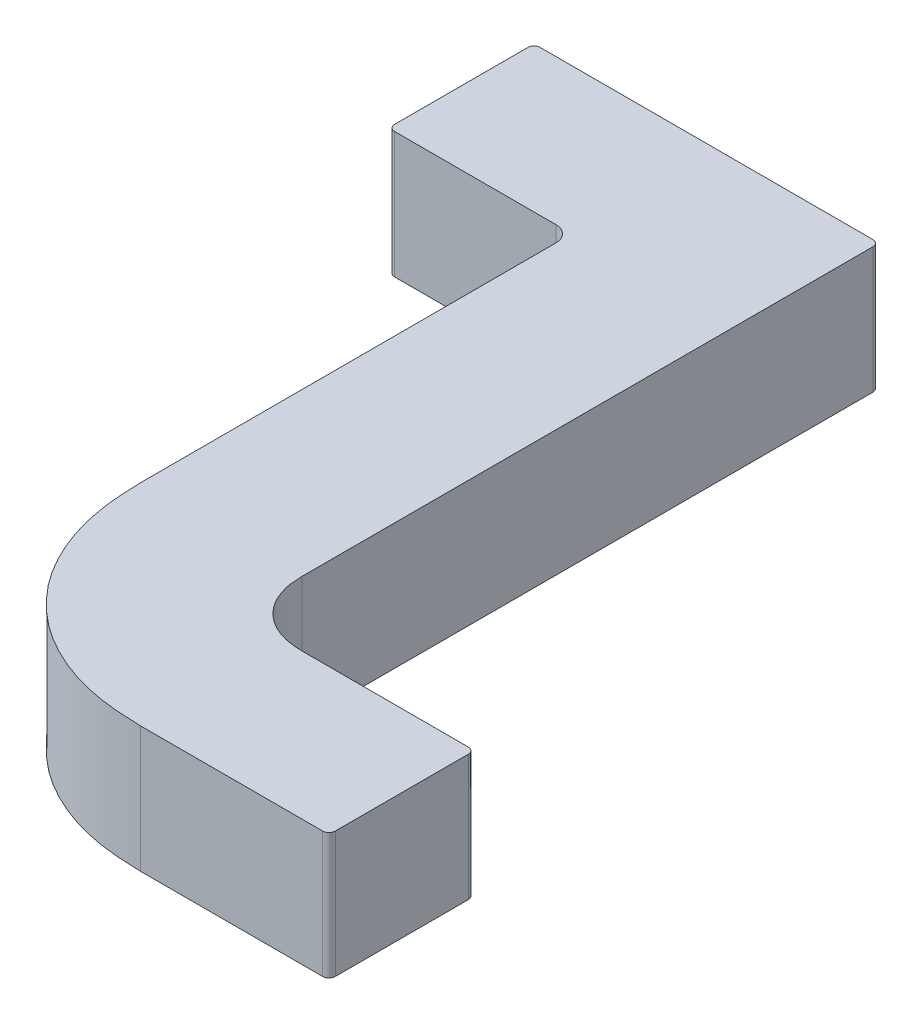
from build123d import *

# Parameters (mm, degrees)
BOSS_EXTRUDE1_DEPTH = 20
FILLET1_R           = 2.5
FILLET2_R           = 1


with BuildPart() as part:
    # Sketch1 → Boss-Extrude1 (new body)
    with BuildSketch(Plane(origin=(0, 0, 0), x_dir=(1, 0, 0), z_dir=(0, 1, 0))):
        with BuildLine():
            add(Edge.make_bspline(
                [(66.785572731, 0), (65.180738733, 0.054671083), (62.042961796, 0.161564173), (57.483422286, 0.927629424), (53.226087858, 2.248485383), (49.300163086, 4.093927927), (45.706807663, 6.38128482), (42.579503305, 9.186716939), (39.774071186, 12.314021298), (37.486714293, 15.907376721), (35.641271749, 19.833301493), (34.320415789, 24.090635921), (33.554350539, 28.65017543), (33.447457449, 31.787952367), (33.392786365, 33.392786365)],
                knots=[0, 0, 0, 0, 1.087768186, 2.126808089, 3.123655961, 4.100353148, 5.059975733, 6, 6.940024267, 7.899646852, 8.876344039, 9.873191911, 10.912231814, 12, 12, 12, 12], degree=3))
            Line((33.392786365, 33.392786365), (33.392786365, 101.887633769))
            Line((33.392786365, 101.887633769), (4.285572731, 101.887633769))
            Line((4.285572731, 101.887633769), (4.285572731, 125))
            Line((4.285572731, 125), (59.081450654, 125))
            Line((59.081450654, 125), (59.081450654, 33.392786365))
            add(Edge.make_bspline(
                [(59.081450654, 33.392786365), (59.109085671, 32.653826149), (59.162403998, 31.228094331), (59.729901482, 29.220411071), (60.610011976, 27.42312516), (61.857229604, 25.888144946), (63.392207772, 24.640926671), (65.189502542, 23.760820831), (67.189160306, 23.195562332), (68.606475262, 23.140665469), (69.337098692, 23.112366231)],
                knots=[0, 0, 0, 0, 1.083242442, 2.089981545, 3.039600891, 4.006048006, 4.972495121, 5.922114466, 6.928853569, 8, 8, 8, 8], degree=3))
            Line((69.337098692, 23.112366231), (96.735037654, 23.112366231))
            Line((96.735037654, 23.112366231), (96.735037654, 0))
            Line((96.735037654, 0), (66.785572731, 0))
        make_face()
    extrude(amount=-BOSS_EXTRUDE1_DEPTH)

    # Fillet1
    fillet1_edges = [part.edges().sort_by_distance(p)[0] for p in [
        (33.392786365, -10, -101.887633769),
    ]]
    fillet(fillet1_edges, radius=FILLET1_R)

    # Fillet2
    fillet2_edges = [part.edges().sort_by_distance(p)[0] for p in [
        (4.285572731, -10, -125),
        (4.285572731, -10, -101.887633769),
        (59.081450654, -10, -125),
        (96.735037654, -10, 0),
        (96.735037654, -10, -23.112366231),
    ]]
    fillet(fillet2_edges, radius=FILLET2_R)


solid = part.part
